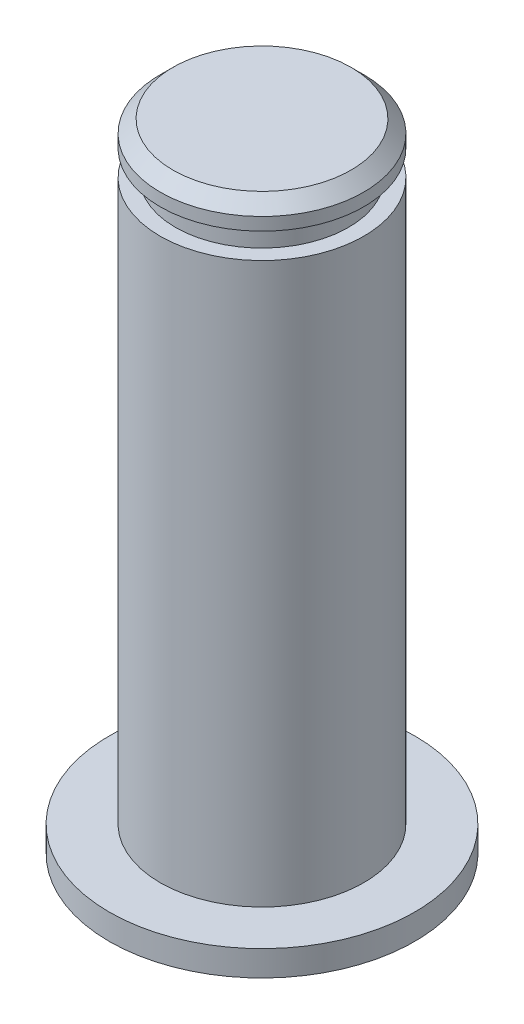
from build123d import *

# Parameters (mm, degrees)
CHAMFER_1_SIZE = 0.5


with BuildPart() as part:
    # Эскиз1 → Повернуть1 (revolve)
    with BuildSketch(Plane.XY):
        Polygon((-4, 25), (0, 25), (0, 0), (-6, 0), (-6, 1), (-4, 1), (-4, 23), (-3.4, 23), (-3.4, 24), (-4, 24), align=None)
    revolve(axis=Axis((0, 0, 0), (0, -1, 0)))

    # Фаска1
    chamfer_1_edges = [part.edges().sort_by_distance(p)[0] for p in [
        (4, 25, 0),
    ]]
    chamfer(chamfer_1_edges, length=CHAMFER_1_SIZE)


solid = part.part
